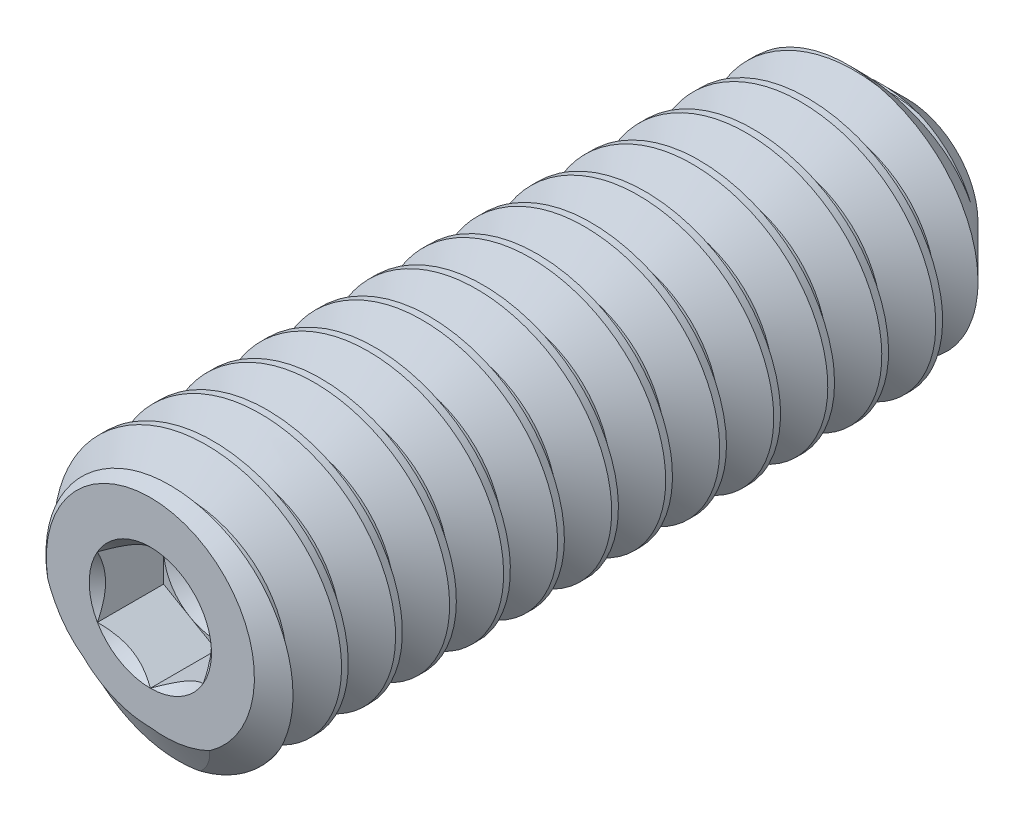
from build123d import *

# Parameters (mm, degrees)
CUT_EXTRUDE10_DEPTH = 0.555625
CUT_SWEEP1_PITCH    = 0.453571429


with BuildPart() as part:
    # Sketch22 → Revolve1 (revolve)
    with BuildSketch(Plane(origin=(0, 0, 0), x_dir=(0, 0, -1), z_dir=(1, 0, 0)), mode=Mode.PRIVATE) as revolve1_sk:
        Polygon((-2.995196284, 0), (-2.995196284, 0.87376), (-2.842242949, 1.0922), (2.861090987, 1.0922), (3.354803716, 0.598487271), (2.995196284, 0), align=None)
    revolve(revolve1_sk.sketch.rotate(Axis((0, 0, -2.995196284), (0, 0, -1)), 180), axis=Axis((0, 0, -2.995196284), (0, 0, -1)))

    # Sketch23 → Cut-Extrude10 (cut)
    with BuildSketch(Plane.XY.offset(2.995196284)):
        Polygon((0, 0.513264389), (-0.4445, 0.256632195), (-0.4445, -0.256632195), (0, -0.513264389), (0.4445, -0.256632195), (0.4445, 0.256632195), align=None)
    extrude(amount=-CUT_EXTRUDE10_DEPTH, mode=Mode.SUBTRACT)

    # Cut-Extrude11 cone 1 section (through the dimple's axis) → Cut-Extrude11 (revolve, cut)
    with BuildSketch(Plane(origin=(0, 0, 2.995196284), x_dir=(0, -1, 0), z_dir=(1, 0, 0))):
        Polygon((0, 0), (0.513264389, 0), (0, 0.513264389), align=None)
    revolve(axis=Axis((0, 0, 2.995196284), (0, 0, -1)), mode=Mode.SUBTRACT)

    # Cut-Extrude12 cone 1 section (through the dimple's axis) → Cut-Extrude12 (revolve, cut)
    with BuildSketch(Plane(origin=(0, 0, 2.439571284), x_dir=(0, -1, 0), z_dir=(1, 0, 0))):
        Polygon((0, 0), (0.4445, 0), (0, 0.256632195), align=None)
    revolve(axis=Axis((0, 0, 2.439571284), (0, 0, -1)), mode=Mode.SUBTRACT)

    # Cut-Sweep1: the profile of Sketch32 screwed along a right-hand helix of 15 turns, 6 arcs to a turn; built about Z, then put on its axis
    cut_sweep1_z = Axis((0, 0, 0), (0, 0, 1))
    cut_sweep1_corners = [(0.797596715, 0, -0.170089286), (0.797596715, 0, -0.226785714), (1.116750274, 0, -0.411049107), (1.116750274, 0, 0.014174107)]
    with BuildLine(mode=Mode.PRIVATE) as cut_sweep1_profile:
        Line(cut_sweep1_corners[0], cut_sweep1_corners[1])
        Line(cut_sweep1_corners[1], cut_sweep1_corners[2])
        Line(cut_sweep1_corners[2], cut_sweep1_corners[3])
        Line(cut_sweep1_corners[3], cut_sweep1_corners[0])
    cut_sweep1_cap = Face(cut_sweep1_profile.wire())
    cut_sweep1_turn_angles = [0, 30, 60, 90, 120, 150, 180, 210, 240, 270, 300, 330, 360]
    cut_sweep1_turn_weights = [1, 0.8660254037844387, 1, 0.8660254037844387, 1, 0.8660254037844387, 1, 0.8660254037844387, 1, 0.8660254037844387, 1, 0.8660254037844387, 1]
    cut_sweep1_turn_rails = [Edge.make_bspline([Vector(p[0], p[1], 0).rotate(cut_sweep1_z, cut_sweep1_turn_angles[k]) / cut_sweep1_turn_weights[k] + Vector(0, 0, p[2] + CUT_SWEEP1_PITCH * cut_sweep1_turn_angles[k] / 360) for k in range(13)], [0, 0, 0, 1, 1, 2, 2, 3, 3, 4, 4, 5, 5, 6, 6, 6], 2, cut_sweep1_turn_weights) for p in cut_sweep1_corners]
    cut_sweep1_turn_sides = [Face.make_surface_from_curves(cut_sweep1_turn_rails[p[0]], cut_sweep1_turn_rails[p[1]]) for p in [(0, 1), (1, 2), (2, 3), (3, 0)]]
    cut_sweep1 = Plane(origin=(0, 0, -3.354803716), x_dir=(0, 1, 0), z_dir=(0, 0, 1)) * Solid(Shell([*[p.moved(Location((0, 0, CUT_SWEEP1_PITCH * i))) for i in range(15) for p in cut_sweep1_turn_sides], cut_sweep1_cap, cut_sweep1_cap.rotate(cut_sweep1_z, 5400).moved(Location((0, 0, CUT_SWEEP1_PITCH * 5400 / 360)))]))
    add(cut_sweep1, mode=Mode.SUBTRACT)


solid = part.part
